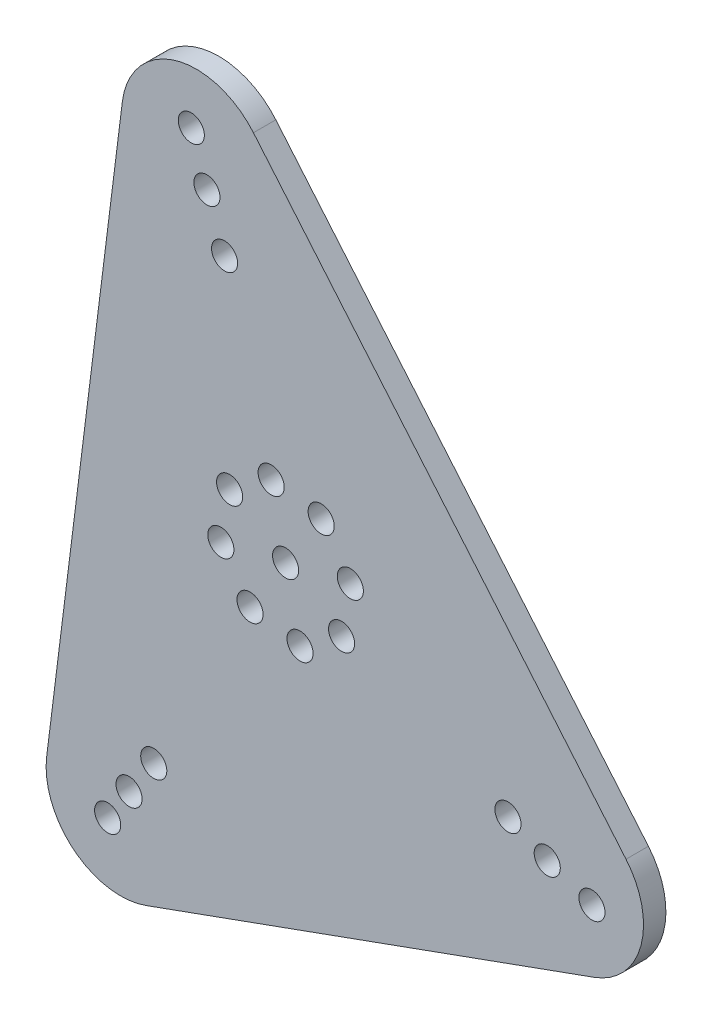
from build123d import *

# Parameters (mm, degrees)
BOSS_EXTRUDE1_DEPTH = 3
SKETCH2_R           = 1.75
CUT_EXTRUDE1_DEPTH  = 79.011344248
SKETCH3_R           = 1.75
CUT_EXTRUDE2_DEPTH  = 79.011344248
SKETCH4_R           = 1.75
CUT_EXTRUDE3_DEPTH  = 79.011344248
CIRPATTERN1_COUNT   = 8


with BuildPart() as part:
    # Sketch1 → Boss-Extrude1 (new body)
    with BuildSketch(Plane.XY):
        with BuildLine():
            Line((0.667294477, 53.640473065), (50.610797782, -5.724077468))
            ThreePointArc((50.610797782, -5.724077468), (52.616471778, -14.75541002), (46.356244968, -21.566963156))
            Line((46.356244968, -21.566963156), (-13.728600931, -43.272522672))
            ThreePointArc((-13.728600931, -43.272522672), (-23.369628732, -41.678891489), (-27.048853068, -32.626135793))
            Line((-27.048853068, -32.626135793), (-16.907510474, 48.443974255))
            ThreePointArc((-16.907510474, 48.443974255), (-9.820285912, 56.792305843), (0.667294477, 53.640473065))
        make_face()
    extrude(amount=BOSS_EXTRUDE1_DEPTH)

    # Sketch2 → Cut-Extrude1 (cut, through all)
    with BuildSketch(Plane(origin=(0, 0, 0), x_dir=(-1, 0, 0), z_dir=(0, 0, -1))):
        with Locations((7.662708152, 50.042478304)):
            Circle(SKETCH2_R)
        with Locations((5.568181142, 43.89402805)):
            Circle(SKETCH2_R)
        with Locations((3.203392583, 37.407750859)):
            Circle(SKETCH2_R)
        with Locations((-46.045216246, -13.318834496)):
            Circle(SKETCH2_R)
        with Locations((-40.049199897, -11.164744014)):
            Circle(SKETCH2_R)
        with Locations((-34.786550097, -8.721370892)):
            Circle(SKETCH2_R)
        with Locations((18.872300715, -35.648381692)):
            Circle(SKETCH2_R)
        with Locations((16.008410719, -31.173553574)):
            Circle(SKETCH2_R)
        with Locations((12.697037912, -26.251242645)):
            Circle(SKETCH2_R)
    extrude(amount=-CUT_EXTRUDE1_DEPTH, mode=Mode.SUBTRACT)

    # Sketch3 → Cut-Extrude2 (cut, through all)
    with BuildSketch(Plane(origin=(0, 0, 0), x_dir=(-1, 0, 0), z_dir=(0, 0, -1))):
        with Locations((-4.977099564, 5.855632234)):
            Circle(SKETCH3_R)
    extrude(amount=-CUT_EXTRUDE2_DEPTH, mode=Mode.SUBTRACT)

    # Sketch4 → Cut-Extrude3 (cut, through all)
    with BuildSketch(Plane(origin=(0, 0, 0), x_dir=(-1, 0, 0), z_dir=(0, 0, -1))):
        with Locations((-3.041357656, 14.534683012)):
            Circle(SKETCH4_R)
    cut_extrude3 = extrude(amount=-CUT_EXTRUDE3_DEPTH, mode=Mode.SUBTRACT)

    # CirPattern1: Cut-Extrude3 ×8 about axis
    cirpattern1_axis = Axis((4.977099564, 5.855632234, 0), (0, 0, -1))
    for i in range(1, CIRPATTERN1_COUNT):
        add(cut_extrude3.rotate(cirpattern1_axis, i * 360 / CIRPATTERN1_COUNT), mode=Mode.SUBTRACT)


solid = part.part
